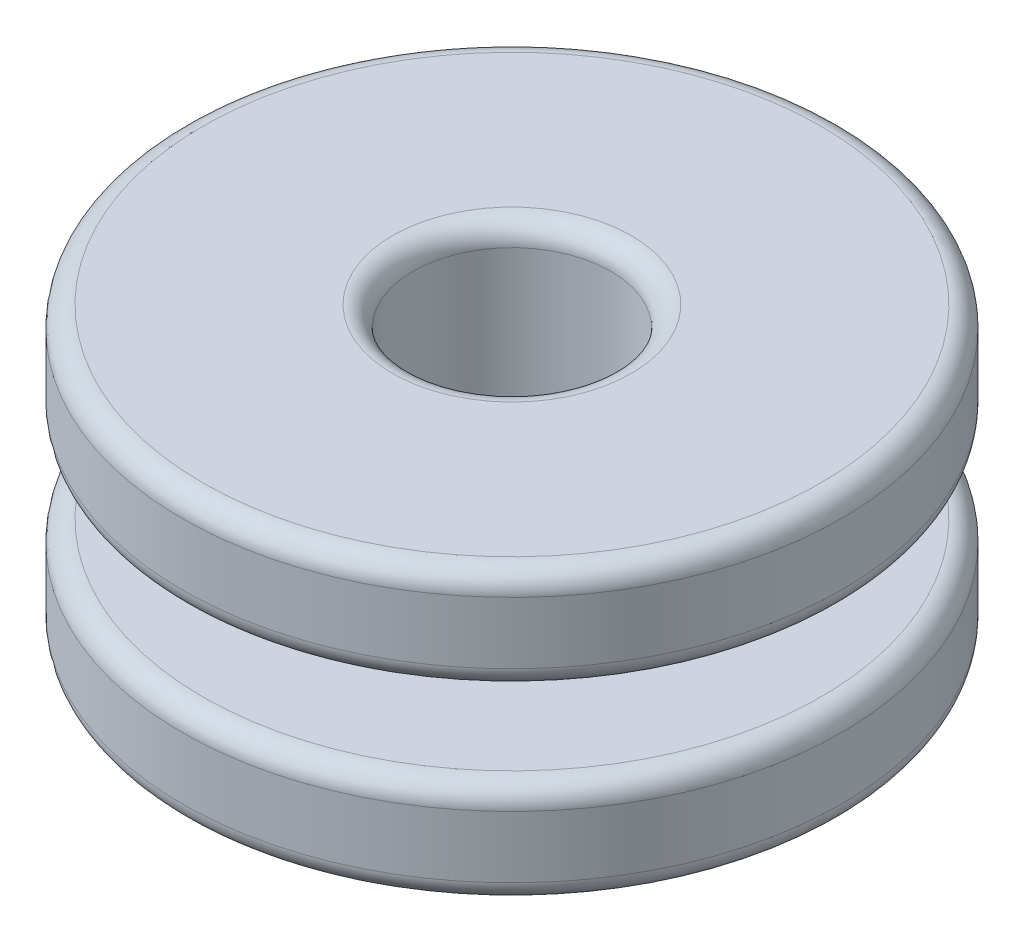
from build123d import *

# Parameters (mm, degrees)
FILLET1_R = 0.5


with BuildPart() as part:
    # Sketch1 → Revolve1 (revolve)
    with BuildSketch(Plane.XY):
        with BuildLine():
            Line((1.2, 3.5), (1.2, -3.5))
            Line((1.2, -3.5), (6.8, -3.5))
            Line((6.8, -3.5), (6.8, -1))
            Line((6.8, -1), (3.2, -1))
            ThreePointArc((3.2, -1), (2.2, 0), (3.2, 1))
            Line((3.2, 1), (6.8, 1))
            Line((6.8, 1), (6.8, 3.5))
            Line((6.8, 3.5), (1.2, 3.5))
        make_face()
    revolve(axis=Axis((-1.2, -3.5, 0), (0, 1, 0)))

    # Fillet1
    fillet1_edges = [part.edges().sort_by_distance(p)[0] for p in [
        (-3.6, -3.5, 0),
        (-9.2, -3.5, 0),
        (-3.6, 3.5, 0),
        (-9.2, 3.5, 0),
        (-9.2, -1, 0),
        (-9.2, 1, 0),
    ]]
    fillet(fillet1_edges, radius=FILLET1_R)


solid = part.part
